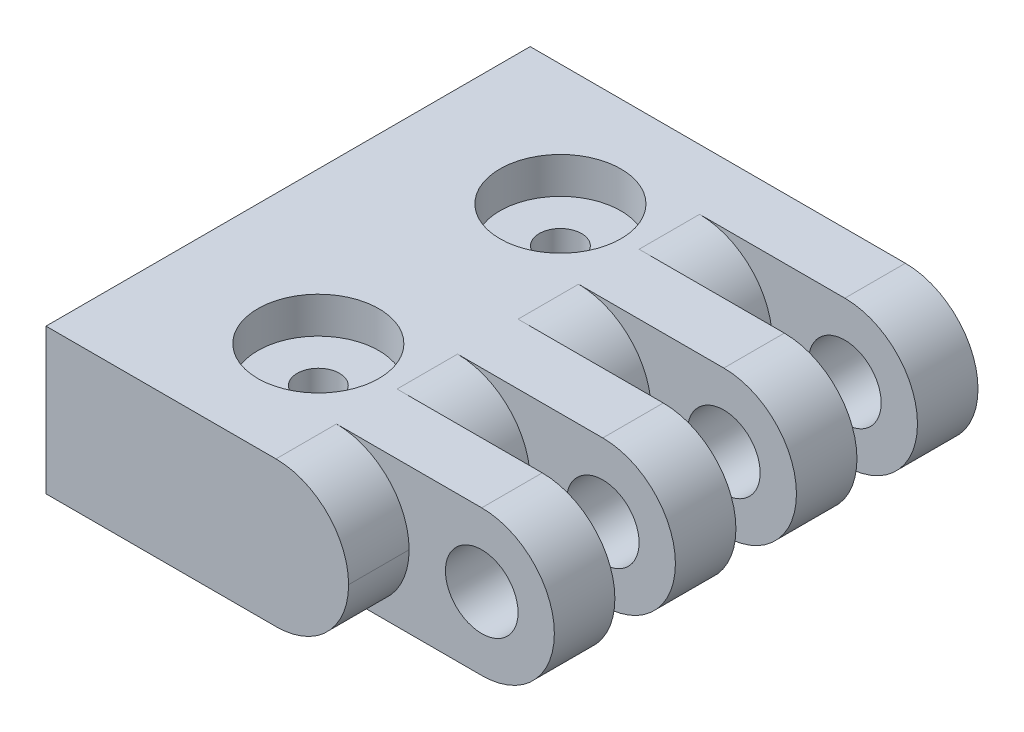
from build123d import *

# Parameters (mm, degrees)
SKETCH1_W           = 25
SKETCH1_H           = 40
BOSS_EXTRUDE1_DEPTH = 12
SKETCH2_R           = 3
BOSS_EXTRUDE2_DEPTH = 40
SKETCH3_W           = 12
SKETCH3_H           = 5
CUT_EXTRUDE1_DEPTH  = 49.672374095
LPATTERN1_COUNT     = 4
LPATTERN1_PITCH     = 10
SKETCH4_R           = 1.75
CUT_EXTRUDE2_DEPTH  = 49.672374095
SKETCH5_R           = 5
CUT_EXTRUDE3_DEPTH  = 3
LPATTERN2_COUNT     = 2
LPATTERN2_PITCH     = 9
FILLET1_R           = 6


with BuildPart() as part:
    # Sketch1 → Boss-Extrude1 (new body)
    with BuildSketch(Plane(origin=(0, 0, 0), x_dir=(1, 0, 0), z_dir=(0, 1, 0))):
        with Locations((-12.5, 20)):
            Rectangle(SKETCH1_W, SKETCH1_H)
    extrude(amount=BOSS_EXTRUDE1_DEPTH)

    # Sketch2 → Boss-Extrude2 (add)
    with BuildSketch(Plane.XY):
        with BuildLine():
            Line((0, 6), (0, 0))
            Line((0, 0), (6, 0))
            ThreePointArc((6, 0), (12, 6), (6, 12))
            Line((6, 12), (0, 12))
            Line((0, 12), (0, 6))
        make_face()
        with Locations((6, 6)):
            Circle(SKETCH2_R, mode=Mode.SUBTRACT)
    extrude(amount=-BOSS_EXTRUDE2_DEPTH)

    # Sketch3 → Cut-Extrude1 (cut, through all)
    with BuildSketch(Plane(origin=(0, 12, 0), x_dir=(1, 0, 0), z_dir=(0, 1, 0))):
        with Locations((6, 32.5)):
            Rectangle(SKETCH3_W, SKETCH3_H)
    cut_extrude1 = extrude(amount=-CUT_EXTRUDE1_DEPTH, mode=Mode.SUBTRACT)

    # LPattern1: Cut-Extrude1 ×4
    with Locations(*[(0, 0, i * LPATTERN1_PITCH) for i in range(1, LPATTERN1_COUNT)]):
        add(cut_extrude1, mode=Mode.SUBTRACT)

    # Sketch4 → Cut-Extrude2 (cut, through all)
    with BuildSketch(Plane(origin=(0, 12, 0), x_dir=(1, 0, 0), z_dir=(0, 1, 0))):
        with Locations(Location((-12.5, 30, 0), (0, 0, 270))):
            Circle(SKETCH4_R)
        with Locations(Location((-12.5, 10, 0), (0, 0, 270))):
            Circle(SKETCH4_R)
    extrude(amount=-CUT_EXTRUDE2_DEPTH, mode=Mode.SUBTRACT)

    # Sketch5 → Cut-Extrude3 (cut)
    with BuildSketch(Plane(origin=(0, 12, 0), x_dir=(1, 0, 0), z_dir=(0, 1, 0))):
        with Locations(Location((-12.5, 30, 0), (0, 0, 270))):
            Circle(SKETCH5_R)
        with Locations(Location((-12.5, 10, 0), (0, 0, 270))):
            Circle(SKETCH5_R)
    cut_extrude3 = extrude(amount=-CUT_EXTRUDE3_DEPTH, mode=Mode.SUBTRACT)

    # LPattern2: Cut-Extrude3 ×2
    with Locations(*[(0, -i * LPATTERN2_PITCH, 0) for i in range(1, LPATTERN2_COUNT)]):
        add(cut_extrude3, mode=Mode.SUBTRACT)

    # Fillet1
    fillet1_edges = [part.edges().sort_by_distance(p)[0] for p in [
        (0, 0, -2.5),
        (0, 12, -2.5),
        (0, 0, -12.5),
        (0, 12, -12.5),
        (0, 0, -22.5),
        (0, 12, -22.5),
        (0, 0, -32.5),
        (0, 12, -32.5),
    ]]
    fillet(fillet1_edges, radius=FILLET1_R - 0.0001)  # a hair under: the kernel refuses the full size


solid = part.part
